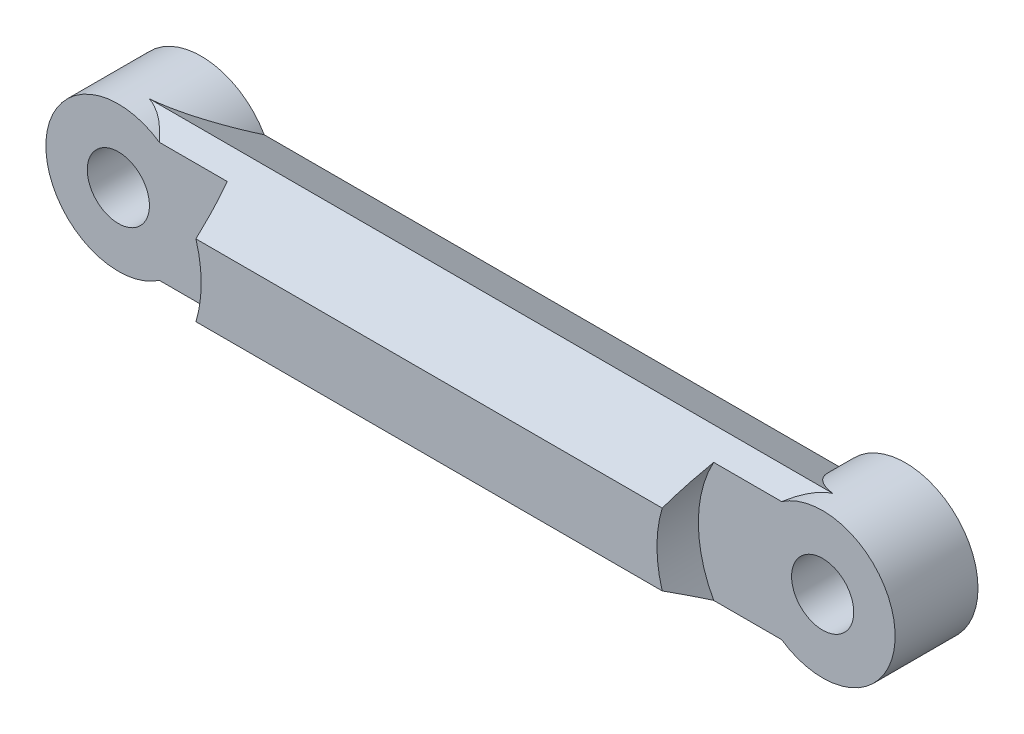
from build123d import *

# Parameters (mm, degrees)
SKETCH1_R                            = 3.5
SKETCH1_R_2                          = 1.5
BOSS_EXTRUDE1_DEPTH                  = 3
BOSS_EXTRUDE1_2_DEPTH                = 3
BOSS_EXTRUDE2_REACH                  = 23.012
BOSS_EXTRUDE2_END_RADIUS             = 3.5
BOSS_EXTRUDE2_DIRECTION_2_REACH      = 23.012
BOSS_EXTRUDE2_DIRECTION_2_END_RADIUS = 3.5
SKETCH3_R                            = 6
CUT_EXTRUDE1_DEPTH                   = 2


with BuildPart() as part:
    # Sketch1 → Boss-Extrude1 (new, symmetric)
    with BuildSketch(Plane.XY):
        with Locations((-17, 0)):
            Circle(SKETCH1_R)
        with Locations((-17, 0)):
            Circle(SKETCH1_R_2, mode=Mode.SUBTRACT)
    extrude(amount=BOSS_EXTRUDE1_DEPTH, both=True)



with BuildPart() as body_2:
    # Sketch1 → Boss-Extrude1 2 (new, symmetric)
    with BuildSketch(Plane.XY):
        with Locations((17, 0)):
            Circle(SKETCH1_R)
        with Locations((17, 0)):
            Circle(SKETCH1_R_2, mode=Mode.SUBTRACT)
    extrude(amount=BOSS_EXTRUDE1_2_DEPTH, both=True)


with BuildPart() as part_1:
    add(part.part)

    add(body_2.part)  # Boss-Extrude2 merges body 2
    # Boss-Extrude2: up to this cylinder (the profile starts outside it)
    boss_extrude2_end = Plane(origin=(-17, 0, 0), z_dir=(0, 0, -1)) * Cylinder(BOSS_EXTRUDE2_END_RADIUS, 54.024, mode=Mode.PRIVATE)
    # Sketch2 → Boss-Extrude2 (add, up to the surface)
    with BuildSketch(Plane(origin=(0, 0, 0), x_dir=(0, 0, -1), z_dir=(1, 0, 0)), mode=Mode.PRIVATE) as boss_extrude2_sk1:
        Polygon((-3, 1.732050808), (-3, -1.732050808), (0, -3.464101615), (3, -1.732050808), (3, 1.732050808), (0, 3.464101615), align=None)
    boss_extrude2_tool1 = extrude(boss_extrude2_sk1.sketch, amount=-BOSS_EXTRUDE2_REACH, mode=Mode.PRIVATE) - boss_extrude2_end
    add(boss_extrude2_tool1.solids().sort_by_distance((0, 0, 0))[0])

    # Boss-Extrude2 direction 2: up to this cylinder (the profile starts outside it)
    boss_extrude2_direction_2_end = Plane(origin=(17, 0, 0), z_dir=(0, 0, -1)) * Cylinder(BOSS_EXTRUDE2_DIRECTION_2_END_RADIUS, 54.024, mode=Mode.PRIVATE)
    # Sketch2 → Boss-Extrude2 direction 2 (add, up to the surface)
    with BuildSketch(Plane(origin=(0, 0, 0), x_dir=(0, 0, -1), z_dir=(1, 0, 0)), mode=Mode.PRIVATE) as boss_extrude2_direction_2_sk1:
        Polygon((-3, 1.732050808), (-3, -1.732050808), (0, -3.464101615), (3, -1.732050808), (3, 1.732050808), (0, 3.464101615), align=None)
    boss_extrude2_direction_2_tool1 = extrude(boss_extrude2_direction_2_sk1.sketch, amount=BOSS_EXTRUDE2_DIRECTION_2_REACH, mode=Mode.PRIVATE) - boss_extrude2_direction_2_end
    add(boss_extrude2_direction_2_tool1.solids().sort_by_distance((0, 0, 0))[0])

    # Sketch3 → Cut-Extrude1 (cut)
    with BuildSketch(Plane.XY.offset(3)):
        with Locations((-17, 0)):
            Circle(SKETCH3_R)
        with Locations((17, 0)):
            Circle(SKETCH3_R)
    extrude(amount=-CUT_EXTRUDE1_DEPTH, mode=Mode.SUBTRACT)


solid = part_1.part
